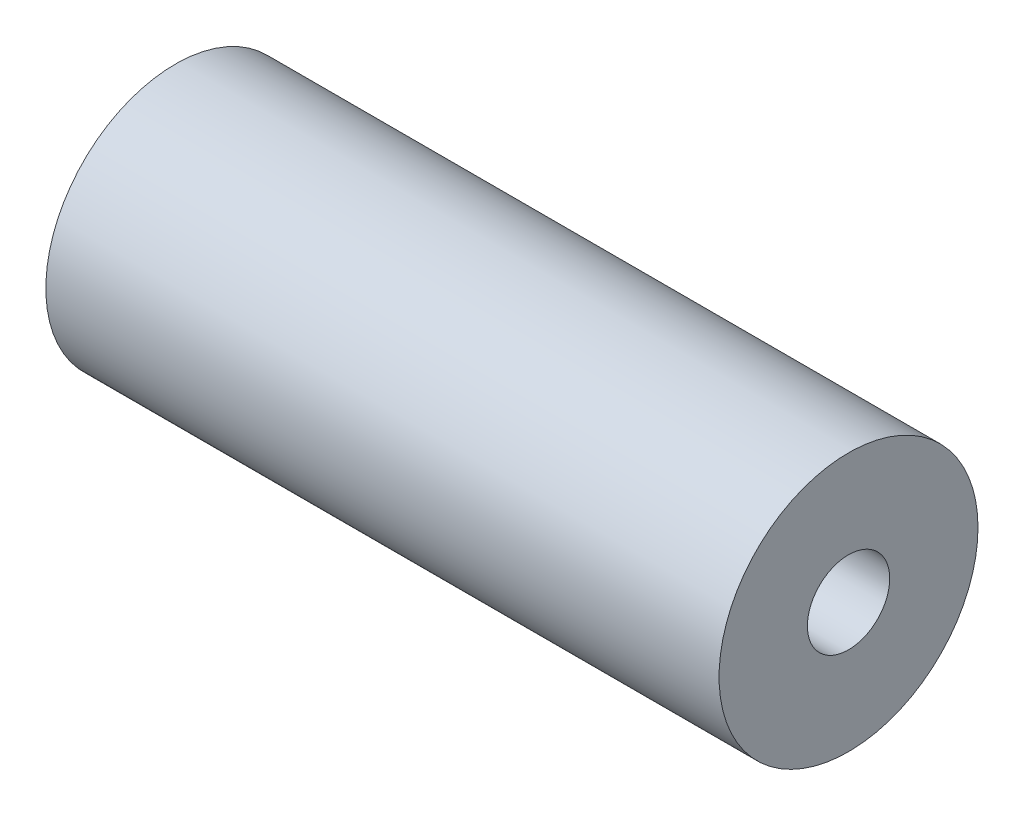
from build123d import *

# Parameters (mm, degrees)
SKETCH1_R           = 6.35
BOSS_EXTRUDE1_DEPTH = 16.51


with BuildPart() as part:
    # Sketch1 → Boss-Extrude1 (new, symmetric)
    with BuildSketch(Plane(origin=(0, 0, 0), x_dir=(0, 0, -1), z_dir=(1, 0, 0))):
        Circle(SKETCH1_R)
    extrude(amount=BOSS_EXTRUDE1_DEPTH, both=True)

    # Sketch3 → Tap Drill for #10-32 Tap1 (revolve, cut)
    with BuildSketch(Plane(origin=(16.51, 0, 0), x_dir=(0, 0, -1), z_dir=(0, 1, 0))):
        Polygon((0, 0), (0, 12.135317848), (2.0193, 10.922), (2.0193, 0), align=None)
    tap_drill_for_10_32_tap1 = revolve(axis=Axis((22.86, 0, 0), (-1, 0, 0)), mode=Mode.SUBTRACT)

    # Mirror1: Tap Drill for #10-32 Tap1 across plane
    add(tap_drill_for_10_32_tap1.mirror(Plane(origin=(0, 0, 0), x_dir=(0, 0, 1), z_dir=(1, 0, 0))), mode=Mode.SUBTRACT)


solid = part.part
